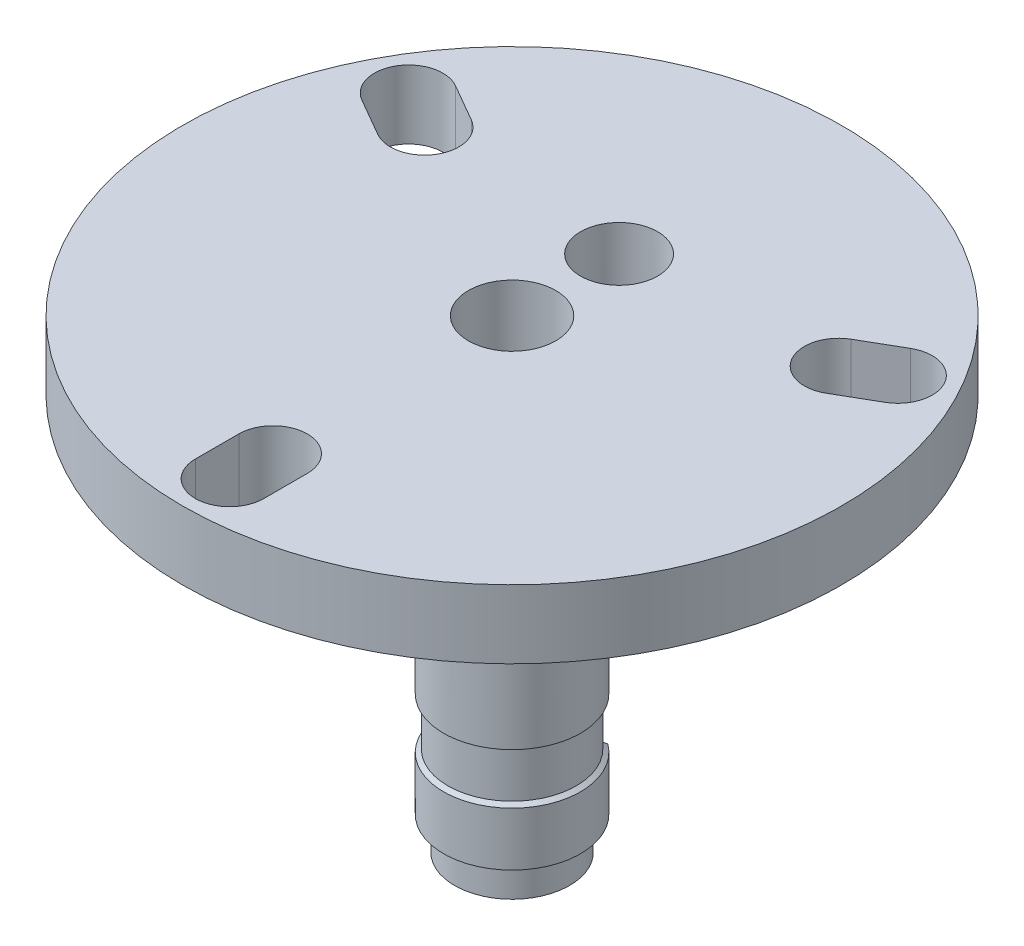
from build123d import *

# Parameters (mm, degrees)
SKETCH1_R               = 19.25
SKETCH1_R_2             = 4
BOSS_EXTRUDE1_DEPTH     = 4
SKETCH1_4_R             = 4
BOSS_EXTRUDE2_DEPTH     = 27.15
CUT_EXTRUDE1_START      = -1.932
SKETCH6_R               = 4
SKETCH6_R_2             = 3.356
CUT_EXTRUDE1_DEPTH      = 1.932
SKETCH8_R               = 2.5
CUT_EXTRUDE3_DEPTH      = 5
CHAMFER1_SIZE           = 2
CHAMFER1_SIZE2          = 0.727940469
SKETCH9_W               = 0.25
SKETCH9_H               = 2.75
CHAMFER3_SIZE           = 0.3
CHAMFER3_SIZE_2         = 0.210062261
FILLET3_SIZE            = 10
FILLET3_SIZE_2          = 7.5
CUT_EXTRUDE2_DEPTH      = 36.735801376
CUT_EXTRUDE2_DEPTH_BACK = 36.735801376
SKETCH7_R               = 2.25


with BuildPart() as part:
    # Sketch1 → Boss-Extrude1 (new body)
    # profile 1 of 2: a face of its own
    with BuildSketch(Plane(origin=(0, 0, 0), x_dir=(1, 0, 0), z_dir=(0, 1, 0))):
        with Locations(Location((0, 0, 0), (0, 0, 270))):
            Circle(SKETCH1_R)
        with BuildLine():
            ThreePointArc((2, -16.5), (0, -18.5), (-2, -16.5))
            Line((-2, -16.5), (-2, -16.378339354))
            ThreePointArc((-2, -16.378339354), (-14.289419162, -8.25), (-15.184057953, 6.45711887))
            Line((-15.184057953, 6.45711887), (-15.289419162, 6.517949192))
            ThreePointArc((-15.289419162, 6.517949192), (-16.02146997, 9.25), (-13.289419162, 9.982050808))
            Line((-13.289419162, 9.982050808), (-13.184057953, 9.921220485))
            ThreePointArc((-13.184057953, 9.921220485), (0, 16.5), (13.184057953, 9.921220485))
            Line((13.184057953, 9.921220485), (13.289419162, 9.982050808))
            ThreePointArc((13.289419162, 9.982050808), (16.02146997, 9.25), (15.289419162, 6.517949192))
            Line((15.289419162, 6.517949192), (15.184057953, 6.45711887))
            ThreePointArc((15.184057953, 6.45711887), (16.167667677, 3.294923655), (16.5, 0))
            ThreePointArc((16.5, 0), (12.354149101, -10.937321427), (2, -16.378339354))
            Line((2, -16.378339354), (2, -16.5))
        make_face(mode=Mode.SUBTRACT)
    # profile 2 of 2: a face of its own
    with BuildSketch(Plane(origin=(0, 0, 0), x_dir=(1, 0, 0), z_dir=(0, 1, 0))):
        with BuildLine():
            ThreePointArc((-15.184057953, 6.45711887), (-14.289419162, -8.25), (-2, -16.378339354))
            Line((-2, -16.378339354), (-2, -13.96))
            ThreePointArc((-2, -13.96), (0, -11.96), (2, -13.96))
            Line((2, -13.96), (2, -16.378339354))
            ThreePointArc((2, -16.378339354), (12.354149101, -10.937321427), (16.5, 0))
            ThreePointArc((16.5, 0), (16.167667677, 3.294923655), (15.184057953, 6.45711887))
            Line((15.184057953, 6.45711887), (13.089714637, 5.247949192))
            ThreePointArc((13.089714637, 5.247949192), (10.357663829, 5.98), (11.089714637, 8.712050808))
            Line((11.089714637, 8.712050808), (13.184057953, 9.921220485))
            ThreePointArc((13.184057953, 9.921220485), (0, 16.5), (-13.184057953, 9.921220485))
            Line((-13.184057953, 9.921220485), (-11.094979939, 8.715090731))
            Line((-11.094979939, 8.715090731), (-11.089714637, 8.712050808))
            ThreePointArc((-11.089714637, 8.712050808), (-10.357663829, 5.98), (-13.089714637, 5.247949192))
            Line((-13.089714637, 5.247949192), (-15.184057953, 6.45711887))
        make_face()
        with Locations(Location((0, 0, 0), (0, 0, 270))):
            Circle(SKETCH1_R_2, mode=Mode.SUBTRACT)
    extrude(amount=-BOSS_EXTRUDE1_DEPTH)

    # Sketch1<4> → Boss-Extrude2 (add)
    with BuildSketch(Plane(origin=(0, 0, 0), x_dir=(1, 0, 0), z_dir=(0, 1, 0))):
        with Locations(Location((0, 0, 0), (0, 0, 270))):
            Circle(SKETCH1_4_R)
    extrude(amount=-BOSS_EXTRUDE2_DEPTH)

    # Sketch2 → Cut-Revolve4 (revolve, cut)
    with BuildSketch(Plane(origin=(0, 0, 0), x_dir=(0, 0, -1), z_dir=(1, 0, 0)), mode=Mode.PRIVATE) as cut_revolve4_sk:
        Polygon((0, -27.15), (0.8, -27.15), (0.8, -25.15), (1, 0), (0, 0), align=None)
    revolve(cut_revolve4_sk.sketch.rotate(Axis((0, 0, 0), (0, -1, 0)), 180), axis=Axis((0, 0, 0), (0, -1, 0)), mode=Mode.SUBTRACT)

    # Sketch5 → Cut-Revolve8 (revolve, cut)
    with BuildSketch(Plane.XY, mode=Mode.PRIVATE) as cut_revolve8_sk:
        Polygon((0, -7), (-2.55, -5.527756814), (-2.55, 0), (0, 0), align=None)
    revolve(cut_revolve8_sk.sketch.rotate(Axis((0, 0, 0), (0, -1, 0)), 270), axis=Axis((0, 0, 0), (0, -1, 0)), mode=Mode.SUBTRACT)

    # Sketch6 → Cut-Extrude1 (cut)
    with BuildSketch(Plane.XZ.offset(27.15).offset(CUT_EXTRUDE1_START)):
        with Locations(Location((0, 0, 0), (0, 0, 90))):
            Circle(SKETCH6_R)
        with Locations(Location((0, 0, 0), (0, 0, 270))):
            Circle(SKETCH6_R_2, mode=Mode.SUBTRACT)
    extrude(amount=CUT_EXTRUDE1_DEPTH, mode=Mode.SUBTRACT)

    # Sketch8 → Cut-Extrude3 (cut)
    with BuildSketch(Plane(origin=(0, -23, 0), x_dir=(1, 0, 0), z_dir=(0, 1, 0))):
        with Locations((0, 4)):
            Circle(SKETCH8_R)
    extrude(amount=CUT_EXTRUDE3_DEPTH, mode=Mode.SUBTRACT)

    # Chamfer1
    chamfer1_edges = [part.edges().sort_by_distance(p)[0] for p in [
        (0, -18, -4),
    ]]
    chamfer1_side = [part.faces().sort_by_distance(p)[0] for p in [
        (0, -14.609, -4),
    ]]
    chamfer(chamfer1_edges, length=CHAMFER1_SIZE, length2=CHAMFER1_SIZE2, reference=chamfer1_side[0])

    # Sketch9 → Cut-Revolve9 (revolve, cut)
    with BuildSketch(Plane(origin=(0, 0, 0), x_dir=(0, 0, -1), z_dir=(1, 0, 0)), mode=Mode.PRIVATE) as cut_revolve9_sk:
        with Locations((-3.875, -20.5)):
            Rectangle(SKETCH9_W, SKETCH9_H)
    revolve(cut_revolve9_sk.sketch.rotate(Axis((0, -27.15, 0), (0, 1, 0)), 143.580086271), axis=Axis((0, -27.15, 0), (0, 1, 0)), mode=Mode.SUBTRACT)

    # Chamfer3
    # the kernel refuses this chamfer: 0.3, 0.210062261 mm, written as the material it takes off along each edge
    with BuildSketch(Plane(origin=(0, -21.875, 0), x_dir=(-0.42752924874280274, 0, -0.9040015162981834), z_dir=(0.9040015162981834, 0, -0.42752924874280274))) as chamfer3_piece_1_section:
        Polygon((4 - CHAMFER3_SIZE, 0), (4, -CHAMFER3_SIZE_2 * 1.0000000022), (4, 0), align=None)
    chamfer3_piece_1 = revolve(axis=Axis((0, -21.875, 0), (0, 1, 0)), revolution_arc=154.689138052, mode=Mode.PRIVATE)
    chamfer3_piece_1 = chamfer3_piece_1 - Plane(origin=(0, -21.995167344, 0), x_dir=(0.593698599754949, 0, -0.8046874999955033), z_dir=(0, -1, 0)) * Cylinder(3.75, 16, mode=Mode.PRIVATE)
    add(chamfer3_piece_1, mode=Mode.SUBTRACT)
    with BuildSketch(Plane(origin=(0, -21.875, 0), x_dir=(0, 0, 1), z_dir=(-1, 0, 0))) as chamfer3_piece_2_section:
        Polygon((4 - CHAMFER3_SIZE, 0), (4, -CHAMFER3_SIZE_2 * 1.0000000022), (4, 0), align=None)
    chamfer3_piece_2 = revolve(axis=Axis((0, -21.875, 0), (0, 1, 0)), revolution_arc=154.689138052, mode=Mode.PRIVATE)
    chamfer3_piece_2 = chamfer3_piece_2 - Plane(origin=(0, -21.995167344, 0), x_dir=(0.593698599754949, 0, -0.8046874999955033), z_dir=(0, -1, 0)) * Cylinder(3.75, 16, mode=Mode.PRIVATE)
    add(chamfer3_piece_2, mode=Mode.SUBTRACT)

    # Fillet3
    # an asymmetric fillet: 10, 7.5 mm, written as the material it adds along each edge
    with BuildSketch(Plane(origin=(0, -4, 0), x_dir=(0, 0, 1), z_dir=(-1, 0, 0))) as fillet3_piece_1:
        with BuildLine():
            Bezier((4, -FILLET3_SIZE), (4, 0), (4 + FILLET3_SIZE_2, 0), weights=[1, 0.707106781, 1])
            Line((4 + FILLET3_SIZE_2, 0), (4, 0))
            Line((4, 0), (4, -FILLET3_SIZE))
        make_face()
    revolve(axis=Axis((0, -4, 0), (0, 1, 0)))

    # Sketch7 → Cut-Extrude2 (cut, two sides: drawn at the far end of the back side and taken through both)
    with BuildSketch(Plane.XZ.offset(4).offset(-CUT_EXTRUDE2_DEPTH_BACK)):
        with Locations(Location((0, -6.25, 0), (0, 0, 270))):
            Circle(SKETCH7_R)
    extrude(amount=CUT_EXTRUDE2_DEPTH + CUT_EXTRUDE2_DEPTH_BACK, mode=Mode.SUBTRACT)


solid = part.part
